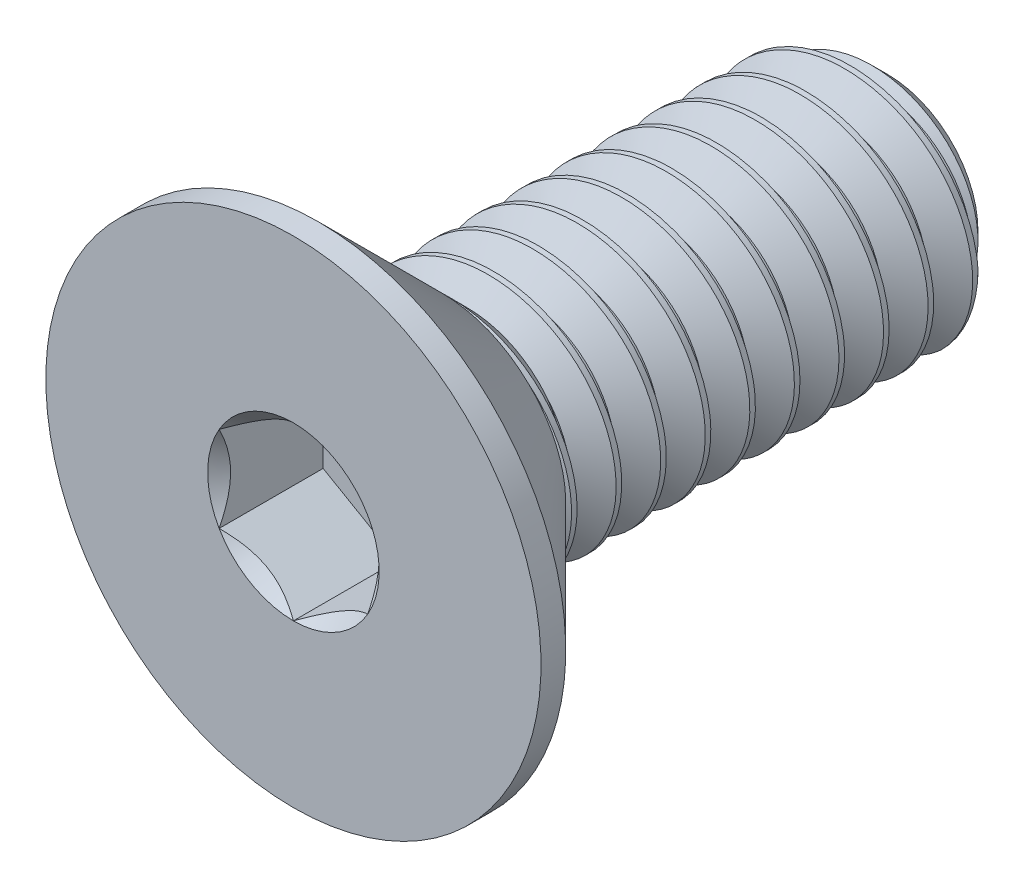
from build123d import *
from build123d.topology import SkipClean

# Parameters (mm, degrees)
SKETCH1_W          = 6
SKETCH1_H          = 1.25
CHAMFER1_SIZE      = 0.3375
CUT_SWEEP1_PITCH   = 0.45
CUT_EXTRUDE2_DEPTH = 1.05


with BuildPart() as part:
    # Sketch1 → Revolve1 (revolve)
    with BuildSketch(Plane(origin=(0, 0, 0), x_dir=(0, 0, -1), z_dir=(1, 0, 0))):
        with Locations((3, 0.625)):
            Rectangle(SKETCH1_W, SKETCH1_H)
    revolve(axis=Axis((0, 0, -6), (0, 0, 1)))

    # Chamfer1
    chamfer1_edges = [part.edges().sort_by_distance(p)[0] for p in [
        (0, -1.25, -6),
    ]]
    chamfer(chamfer1_edges, length=CHAMFER1_SIZE)

    # Cut-Sweep1: arcs per turn and ends read off the stored shape
    # Cut-Sweep1: the profile of Sketch2 profile screwed along a right-hand helix through 15 turns, 6 arcs to a turn; built about Z, then put on its axis
    cut_sweep1_z = Axis((0, 0, 0), (0, 0, 1))
    cut_sweep1_corners = [(1.2506, 0, 0.00034641), (1.2506, 0, -0.39409641), (0.957716426, 0, -0.225), (0.957716426, 0, -0.16875)]
    with BuildLine(mode=Mode.PRIVATE) as cut_sweep1_profile:
        Line(cut_sweep1_corners[0], cut_sweep1_corners[1])
        Line(cut_sweep1_corners[1], cut_sweep1_corners[2])
        Line(cut_sweep1_corners[2], cut_sweep1_corners[3])
        Line(cut_sweep1_corners[3], cut_sweep1_corners[0])
    cut_sweep1_cap = Face(cut_sweep1_profile.wire())
    cut_sweep1_turn_angles = [0, 30, 60, 90, 120, 150, 180, 210, 240, 270, 300, 330, 360]
    cut_sweep1_turn_weights = [1, 0.8660254037844387, 1, 0.8660254037844387, 1, 0.8660254037844387, 1, 0.8660254037844387, 1, 0.8660254037844387, 1, 0.8660254037844387, 1]
    cut_sweep1_turn_rails = [Edge.make_bspline([Vector(p[0], p[1], 0).rotate(cut_sweep1_z, cut_sweep1_turn_angles[k]) / cut_sweep1_turn_weights[k] + Vector(0, 0, p[2] + CUT_SWEEP1_PITCH * cut_sweep1_turn_angles[k] / 360) for k in range(13)], [0, 0, 0, 1, 1, 2, 2, 3, 3, 4, 4, 5, 5, 6, 6, 6], 2, cut_sweep1_turn_weights) for p in cut_sweep1_corners]
    cut_sweep1_turn_sides = [Face.make_surface_from_curves(cut_sweep1_turn_rails[p[0]], cut_sweep1_turn_rails[p[1]]) for p in [(0, 1), (1, 2), (2, 3), (3, 0)]]
    cut_sweep1 = Plane(origin=(0, 0, -6), x_dir=(0, 1, 0), z_dir=(0, 0, 1)) * Solid(Shell([*[p.moved(Location((0, 0, CUT_SWEEP1_PITCH * i))) for i in range(15) for p in cut_sweep1_turn_sides], cut_sweep1_cap, cut_sweep1_cap.rotate(cut_sweep1_z, 5400).moved(Location((0, 0, CUT_SWEEP1_PITCH * 5400 / 360)))]))
    add(cut_sweep1, mode=Mode.SUBTRACT)

    # Sketch7 → Revolve2 (revolve)
    with BuildSketch(Plane(origin=(0, 0, 0), x_dir=(0, 0, -1), z_dir=(1, 0, 0)), mode=Mode.PRIVATE) as revolve2_sk:
        Polygon((0, 2.5), (0.25, 2.5), (1.5, 1.25), (1.5, 0), (0, 0), align=None)
    revolve(revolve2_sk.sketch.rotate(Axis((0, 0, 0), (0, 0, -1)), 189.336081704), axis=Axis((0, 0, 0), (0, 0, -1)))

    # Boss-Extrude1 cone 1 section (through the dimple's axis) → Boss-Extrude1 (revolve)
    with SkipClean():  # the faces are left unmerged after this step: merging them gives an invalid solid
        with BuildSketch(Plane(origin=(0, 0, -1.5), x_dir=(0, -1, 0), z_dir=(1, 0, 0))):
            Polygon((0, 0), (1.25, 0), (0, 1.25), align=None)
        revolve(axis=Axis((0, 0, -1.5), (0, 0, -1)))

    # Sketch5 → Cut-Extrude2 (cut)
    with SkipClean():  # the faces are left unmerged after this step: merging them gives an invalid solid
        with BuildSketch(Plane.XY):
            Polygon((0.75, -0.433012702), (0.75, 0.433012702), (0, 0.866025404), (-0.75, 0.433012702), (-0.75, -0.433012702), (0, -0.866025404), align=None)
        extrude(amount=-CUT_EXTRUDE2_DEPTH, mode=Mode.SUBTRACT)

    # Cut-Extrude3 cone 1 section (through the dimple's axis) → Cut-Extrude3 (revolve, cut)
    with SkipClean():  # the faces are left unmerged after this step: merging them gives an invalid solid
        with BuildSketch(Plane(origin=(0, 0, 0), x_dir=(0, -1, 0), z_dir=(1, 0, 0))):
            Polygon((0, 0), (0.866025404, 0), (0, 0.866025404), align=None)
        revolve(axis=Axis((0, 0, 0), (0, 0, -1)), mode=Mode.SUBTRACT)


solid = part.part
